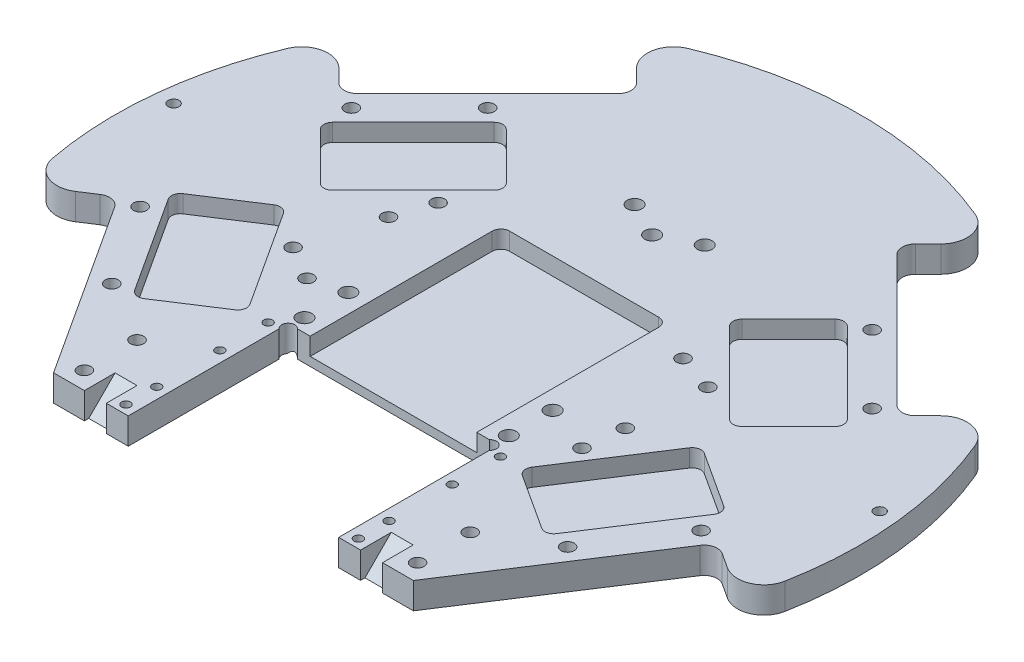
from build123d import *

# Parameters (mm, degrees)
SKETCH1_R                                       = 85
BOSS_EXTRUDE1_DEPTH                             = 6
CUT_EXTRUDE1_REACH                              = 122.358
SKETCH2_R                                       = 1.5
CUT_EXTRUDE2_DEPTH                              = 4
FILLET2_R                                       = 2
FILLET3_R                                       = 6
FILLET4_R                                       = 3
FILLET2_OF_MIRROR1_R                            = 2
FILLET3_OF_MIRROR1_R                            = 6
FILLET4_OF_MIRROR1_R                            = 3
MIRROR2_START                                   = 2
MIRROR2_OUTLINE_R                               = 1.5
MIRROR2_DEPTH                                   = 4
MIRROR2_2_OUTLINE_R                             = 1.5
MIRROR2_2_DEPTH                                 = 2
CUT_EXTRUDE3_REACH                              = 122.358
CUT_EXTRUDE4_REACH                              = 122.358
SKETCH5_R                                       = 1.5
CUT_EXTRUDE5_REACH                              = 122.358
SKETCH6_R                                       = 1.5
CUT_EXTRUDE7_REACH                              = 122.358
SKETCH8_R                                       = 1
SKETCH8_R_2                                     = 1.5
CUT_EXTRUDE8_START                              = -5
CUT_EXTRUDE8_DEPTH                              = 5
CUT_EXTRUDE9_DEPTH                              = 4
CSK_FOR_M3_FLAT_HEAD_MACHINE_SCREW1_D           = 3.4
CSK_FOR_M3_FLAT_HEAD_MACHINE_SCREW1_CSINK_D     = 6.3
CSK_FOR_M3_FLAT_HEAD_MACHINE_SCREW1_CSINK_ANGLE = 90
M3X0_5_TAPPED_HOLE1_D                           = 2.5
M3X0_5_TAPPED_HOLE1_CSINK_D                     = 3.05
M3X0_5_TAPPED_HOLE1_CSINK_ANGLE                 = 90
CHAMFER1_SIZE                                   = 1.65
CHAMFER2_SIZE                                   = 1


# Read off the part's stored shape, not the designer's step: Mirror2
with BuildPart() as part:
    # Sketch1 → Boss-Extrude1 (new body)
    with BuildSketch(Plane(origin=(0, 0, 0), x_dir=(1, 0, 0), z_dir=(0, 1, 0))):
        with Locations(Location((0, 0, 0), (0, 0, 270))):
            Circle(SKETCH1_R)
    extrude(amount=BOSS_EXTRUDE1_DEPTH)

    # Sketch2 → Cut-Extrude1 (cut, up to next)
    with BuildSketch(Plane(origin=(0, 6, 0), x_dir=(1, 0, 0), z_dir=(0, 1, 0)), mode=Mode.PRIVATE) as cut_extrude1_sk1:
        with Locations(Location((-59.39696962, 28.284271247, 0), (0, 0, 270))):
            Circle(SKETCH2_R)
    cut_extrude1_tool1 = extrude(cut_extrude1_sk1.sketch, amount=-CUT_EXTRUDE1_REACH, mode=Mode.PRIVATE) & part.part
    # Sketch2 → Cut-Extrude1 (cut, up to next)
    with BuildSketch(Plane(origin=(0, 6, 0), x_dir=(1, 0, 0), z_dir=(0, 1, 0)), mode=Mode.PRIVATE) as cut_extrude1_sk2:
        with Locations(Location((-43.840620434, 43.840620434, 0), (0, 0, 270))):
            Circle(SKETCH2_R)
    cut_extrude1_tool2 = extrude(cut_extrude1_sk2.sketch, amount=-CUT_EXTRUDE1_REACH, mode=Mode.PRIVATE) & part.part
    # Sketch2 → Cut-Extrude1 (cut, up to next)
    with BuildSketch(Plane(origin=(0, 6, 0), x_dir=(1, 0, 0), z_dir=(0, 1, 0)), mode=Mode.PRIVATE) as cut_extrude1_sk3:
        with BuildLine():
            Line((-40.687914512, 74.629040009), (-29.69848481, 63.639610307))
            Line((-29.69848481, 63.639610307), (-63.639610307, 29.69848481))
            Line((-63.639610307, 29.69848481), (-74.629040009, 40.687914512))
            ThreePointArc((-74.629040009, 40.687914512), (-60.104076401, 60.104076401), (-40.687914512, 74.629040009))
        make_face()
    cut_extrude1_tool3 = extrude(cut_extrude1_sk3.sketch, amount=-CUT_EXTRUDE1_REACH, mode=Mode.PRIVATE) & part.part
    cut_extrude1_1 = cut_extrude1_tool1.solids().sort_by_distance((-59.39697, 6, -28.284271))[0]
    add(cut_extrude1_1, mode=Mode.SUBTRACT)
    cut_extrude1_2 = cut_extrude1_tool2.solids().sort_by_distance((-43.84062, 6, -43.84062))[0]
    add(cut_extrude1_2, mode=Mode.SUBTRACT)
    cut_extrude1_3 = cut_extrude1_tool3.solids().sort_by_distance((-53.003264, 6, -53.003264))[0]
    add(cut_extrude1_3, mode=Mode.SUBTRACT)
    cut_extrude1 = cut_extrude1_1 + cut_extrude1_2 + cut_extrude1_3  # Cut-Extrude1 as one shape, for the pattern or mirror that repeats it

    # Sketch3 → Cut-Extrude2 (cut)
    with BuildSketch(Plane(origin=(0, 6, 0), x_dir=(1, 0, 0), z_dir=(0, 1, 0))):
        Polygon((-60.104076401, 21.920310217), (-38.890872965, 43.133513652), (-25.455844123, 29.69848481), (-46.669047558, 8.485281374), align=None)
    cut_extrude2 = extrude(amount=-CUT_EXTRUDE2_DEPTH, mode=Mode.SUBTRACT)

    # Fillet2
    fillet2_edges = [part.edges().sort_by_distance(p)[0] for p in [
        (-46.669047558, 4, -8.485281374),
        (-60.104076401, 4, -21.920310217),
        (-38.890872965, 4, -43.133513652),
        (-25.455844123, 4, -29.69848481),
    ]]
    fillet(fillet2_edges, radius=FILLET2_R)

    # Fillet3
    fillet3_edges = [part.edges().sort_by_distance(p)[0] for p in [
        (-74.629040009, 3, -40.687914512),
        (-40.687914512, 3, -74.629040009),
    ]]
    fillet(fillet3_edges, radius=FILLET3_R)

    # Fillet4
    fillet4_edges = [part.edges().sort_by_distance(p)[0] for p in [
        (-29.69848481, 3, -63.639610307),
        (-63.639610307, 3, -29.69848481),
    ]]
    fillet(fillet4_edges, radius=FILLET4_R)

    # Mirror1: Cut-Extrude1, Cut-Extrude2 across plane
    add(cut_extrude1.mirror(Plane(origin=(0, 0, 0), x_dir=(0.9945218953682733, 0, 0.10452846326765369), z_dir=(-0.10452846326765369, 0, 0.9945218953682733))), mode=Mode.SUBTRACT)
    add(cut_extrude2.mirror(Plane(origin=(0, 0, 0), x_dir=(0.9945218953682733, 0, 0.10452846326765369), z_dir=(-0.10452846326765369, 0, 0.9945218953682733))), mode=Mode.SUBTRACT)

    # Fillet2 of Mirror1
    fillet2_of_mirror1_edges = [part.edges().sort_by_distance(p)[0] for p in [
        (-47.413406095, 4, -1.403182969),
        (-63.348146886, 4, 8.944958696),
        (-47.008975836, 4, 34.105075735),
        (-31.074235045, 4, 23.756934069),
    ]]
    fillet(fillet2_of_mirror1_edges, radius=FILLET2_OF_MIRROR1_R)

    # Fillet3 of Mirror1
    fillet3_of_mirror1_edges = [part.edges().sort_by_distance(p)[0] for p in [
        (-81.457709532, 3, 24.282536066),
        (-55.315035851, 3, 64.538723328),
    ]]
    fillet(fillet3_of_mirror1_edges, radius=FILLET3_OF_MIRROR1_R)

    # Fillet4 of Mirror1
    fillet4_of_mirror1_edges = [part.edges().sort_by_distance(p)[0] for p in [
        (-42.280920644, 3, 56.074269942),
        (-68.423594325, 3, 15.81808268),
    ]]
    fillet(fillet4_of_mirror1_edges, radius=FILLET4_OF_MIRROR1_R)

    # Mirror2 outline → Mirror2 (cut)
    with BuildSketch(Plane(origin=(0, 0, 0), x_dir=(1, 0, 0), z_dir=(0, 1, 0)).offset(MIRROR2_START)):
        with BuildLine():
            ThreePointArc((43.914837749, -53.558258238), (43.496406651, -55.815910416), (44.796932348, -57.708187047))
            Line((44.796932348, -57.708187047), (48.220507685, -59.931482867))
            ThreePointArc((48.220507685, -59.931482867), (50.952027138, -64.875440225), (48.366800574, -69.89744346))
            ThreePointArc((48.366800574, -69.89744346), (71.286998275, -46.294317976), (83.527042075, -15.755419453))
            ThreePointArc((83.527042075, -15.755419453), (79.990720206, -20.159774174), (74.363181366, -19.675295605))
            Line((74.363181366, -19.675295605), (70.939606029, -17.451999785))
            ThreePointArc((70.939606029, -17.451999785), (68.681953851, -17.033568687), (66.78967722, -18.334094384))
            Line((66.78967722, -18.334094384), (43.914837749, -53.558258238))
        make_face()
        with BuildLine():
            ThreePointArc((68.647443459, 34.706317962), (74.051278315, 36.350240628), (78.426039904, 32.777374283))
            ThreePointArc((78.426039904, 32.777374283), (60.1040764, 60.1040764), (32.777374283, 78.426039904))
            ThreePointArc((32.777374283, 78.426039904), (36.350240628, 74.051278315), (34.706317962, 68.647443459))
            Line((34.706317962, 68.647443459), (31.819805153, 65.76093065))
            ThreePointArc((31.819805153, 65.76093065), (30.941125497, 63.639610307), (31.819805153, 61.518289963))
            Line((31.819805153, 61.518289963), (61.518289963, 31.819805153))
            ThreePointArc((61.518289963, 31.819805153), (63.639610307, 30.941125497), (65.76093065, 31.819805153))
            Line((65.76093065, 31.819805153), (68.647443459, 34.706317962))
        make_face()
        with Locations((63.979633983, -15.316867676)):
            Circle(MIRROR2_OUTLINE_R)
        with Locations((51.997575213, -33.767620171)):
            Circle(MIRROR2_OUTLINE_R)
        with BuildLine():
            ThreePointArc((62.258868816, -10.622299832), (62.537822882, -9.11719838), (61.67080575, -7.855680626))
            Line((61.67080575, -7.855680626), (49.090747231, 0.313904899))
            ThreePointArc((49.090747231, 0.313904899), (47.585645779, 0.592858964), (46.324128025, -0.274158167))
            Line((46.324128025, -0.274158167), (32.163513115, -22.079592934))
            ThreePointArc((32.163513115, -22.079592934), (31.884559049, -23.584694385), (32.751576181, -24.846212139))
            Line((32.751576181, -24.846212139), (45.3316347, -33.015797665))
            ThreePointArc((45.3316347, -33.015797665), (46.836736152, -33.29475173), (48.098253906, -32.427734599))
            Line((48.098253906, -32.427734599), (62.258868816, -10.622299832))
        make_face()
        with Locations((59.39696962, 28.284271247)):
            Circle(MIRROR2_OUTLINE_R)
        with Locations((43.840620434, 43.840620434)):
            Circle(MIRROR2_OUTLINE_R)
        with BuildLine():
            Line((48.083261121, 9.899494937), (58.689862838, 20.506096654))
            ThreePointArc((58.689862838, 20.506096654), (59.275649276, 21.920310216), (58.689862838, 23.334523779))
            Line((58.689862838, 23.334523779), (40.305086528, 41.71930009))
            ThreePointArc((40.305086528, 41.71930009), (38.890872966, 42.305086528), (37.476659403, 41.71930009))
            Line((37.476659403, 41.71930009), (26.870057685, 31.112698372))
            ThreePointArc((26.870057685, 31.112698372), (26.284271247, 29.69848481), (26.870057685, 28.284271247))
            Line((26.870057685, 28.284271247), (45.254833996, 9.899494937))
            ThreePointArc((45.254833996, 9.899494937), (46.669047559, 9.313708499), (48.083261121, 9.899494937))
        make_face()
    extrude(amount=MIRROR2_DEPTH, mode=Mode.SUBTRACT)

    # Mirror2 2 outline → Mirror2 2 (cut)
    with BuildSketch(Plane(origin=(0, 0, 0), x_dir=(1, 0, 0), z_dir=(0, 1, 0))):
        with BuildLine():
            ThreePointArc((43.914837749, -53.558258238), (43.496406651, -55.815910416), (44.796932348, -57.708187047))
            Line((44.796932348, -57.708187047), (48.220507685, -59.931482867))
            ThreePointArc((48.220507685, -59.931482867), (50.952027138, -64.875440225), (48.366800574, -69.89744346))
            ThreePointArc((48.366800574, -69.89744346), (71.286998275, -46.294317976), (83.527042075, -15.755419453))
            ThreePointArc((83.527042075, -15.755419453), (79.990720206, -20.159774174), (74.363181366, -19.675295605))
            Line((74.363181366, -19.675295605), (70.939606029, -17.451999785))
            ThreePointArc((70.939606029, -17.451999785), (68.681953851, -17.033568687), (66.78967722, -18.334094384))
            Line((66.78967722, -18.334094384), (43.914837749, -53.558258238))
        make_face()
        with BuildLine():
            ThreePointArc((68.647443459, 34.706317962), (74.051278315, 36.350240628), (78.426039904, 32.777374283))
            ThreePointArc((78.426039904, 32.777374283), (60.1040764, 60.1040764), (32.777374283, 78.426039904))
            ThreePointArc((32.777374283, 78.426039904), (36.350240628, 74.051278315), (34.706317962, 68.647443459))
            Line((34.706317962, 68.647443459), (31.819805153, 65.76093065))
            ThreePointArc((31.819805153, 65.76093065), (30.941125497, 63.639610307), (31.819805153, 61.518289963))
            Line((31.819805153, 61.518289963), (61.518289963, 31.819805153))
            ThreePointArc((61.518289963, 31.819805153), (63.639610307, 30.941125497), (65.76093065, 31.819805153))
            Line((65.76093065, 31.819805153), (68.647443459, 34.706317962))
        make_face()
        with Locations((63.979633983, -15.316867676)):
            Circle(MIRROR2_2_OUTLINE_R)
        with Locations((51.997575213, -33.767620171)):
            Circle(MIRROR2_2_OUTLINE_R)
        with Locations((59.39696962, 28.284271247)):
            Circle(MIRROR2_2_OUTLINE_R)
        with Locations((43.840620434, 43.840620434)):
            Circle(MIRROR2_2_OUTLINE_R)
    extrude(amount=MIRROR2_2_DEPTH, mode=Mode.SUBTRACT)

    # Sketch4 → Cut-Extrude3 (cut, up to next)
    with BuildSketch(Plane(origin=(0, 6, 0), x_dir=(1, 0, 0), z_dir=(0, 1, 0)), mode=Mode.PRIVATE) as cut_extrude3_sk1:
        Polygon((-43.914837749, -53.558258238), (-41.030336922, -58), (-24, -58), (-24, -21.5), (24, -21.5), (24, -58), (41.030336922, -58), (43.914837749, -53.558258238), (50.952673475, -58.128682198), (50.952673475, -85), (-50.952673475, -85), (-50.952673475, -58.128682198), align=None)
    cut_extrude3_tool1 = extrude(cut_extrude3_sk1.sketch, amount=-CUT_EXTRUDE3_REACH, mode=Mode.PRIVATE) & part.part
    add(cut_extrude3_tool1.solids().sort_by_distance((0, 6, 59.123155))[0], mode=Mode.SUBTRACT)

    # Sketch5 → Cut-Extrude4 (cut, up to next)
    with BuildSketch(Plane(origin=(0, 6, 0), x_dir=(1, 0, 0), z_dir=(0, 1, 0)), mode=Mode.PRIVATE) as cut_extrude4_sk1:
        with Locations((-23, -22.5)):
            Circle(SKETCH5_R)
    cut_extrude4_tool1 = extrude(cut_extrude4_sk1.sketch, amount=-CUT_EXTRUDE4_REACH, mode=Mode.PRIVATE) & part.part
    # Sketch5 → Cut-Extrude4 (cut, up to next)
    with BuildSketch(Plane(origin=(0, 6, 0), x_dir=(1, 0, 0), z_dir=(0, 1, 0)), mode=Mode.PRIVATE) as cut_extrude4_sk2:
        with Locations((23, -22.5)):
            Circle(SKETCH5_R)
    cut_extrude4_tool2 = extrude(cut_extrude4_sk2.sketch, amount=-CUT_EXTRUDE4_REACH, mode=Mode.PRIVATE) & part.part
    add(cut_extrude4_tool1.solids().sort_by_distance((-23, 6, 22.5))[0], mode=Mode.SUBTRACT)
    add(cut_extrude4_tool2.solids().sort_by_distance((23, 6, 22.5))[0], mode=Mode.SUBTRACT)

    # Sketch6 → Cut-Extrude5 (cut, up to next)
    with BuildSketch(Plane(origin=(0, 6, 0), x_dir=(1, 0, 0), z_dir=(0, 1, 0)), mode=Mode.PRIVATE) as cut_extrude5_sk1:
        with Locations(Location((-30.759144982, 19.445436483, 0), (0, 0, 270))):
            Circle(SKETCH6_R)
    cut_extrude5_tool1 = extrude(cut_extrude5_sk1.sketch, amount=-CUT_EXTRUDE5_REACH, mode=Mode.PRIVATE) & part.part
    # Sketch6 → Cut-Extrude5 (cut, up to next)
    with BuildSketch(Plane(origin=(0, 6, 0), x_dir=(1, 0, 0), z_dir=(0, 1, 0)), mode=Mode.PRIVATE) as cut_extrude5_sk2:
        with Locations(Location((-33.587572106, 10.960155108, 0), (0, 0, 270))):
            Circle(SKETCH6_R)
    cut_extrude5_tool2 = extrude(cut_extrude5_sk2.sketch, amount=-CUT_EXTRUDE5_REACH, mode=Mode.PRIVATE) & part.part
    # Sketch6 → Cut-Extrude5 (cut, up to next)
    with BuildSketch(Plane(origin=(0, 6, 0), x_dir=(1, 0, 0), z_dir=(0, 1, 0)), mode=Mode.PRIVATE) as cut_extrude5_sk3:
        with Locations(Location((-38.487029722, -5.915956656, 0), (0, 0, 270))):
            Circle(SKETCH6_R)
    cut_extrude5_tool3 = extrude(cut_extrude5_sk3.sketch, amount=-CUT_EXTRUDE5_REACH, mode=Mode.PRIVATE) & part.part
    # Sketch6 → Cut-Extrude5 (cut, up to next)
    with BuildSketch(Plane(origin=(0, 6, 0), x_dir=(1, 0, 0), z_dir=(0, 1, 0)), mode=Mode.PRIVATE) as cut_extrude5_sk4:
        with Locations(Location((-30.77523517, -10.446765059, 0), (0, 0, 270))):
            Circle(SKETCH6_R)
    cut_extrude5_tool4 = extrude(cut_extrude5_sk4.sketch, amount=-CUT_EXTRUDE5_REACH, mode=Mode.PRIVATE) & part.part
    # Sketch6 → Cut-Extrude5 (cut, up to next)
    with BuildSketch(Plane(origin=(0, 6, 0), x_dir=(1, 0, 0), z_dir=(0, 1, 0)), mode=Mode.PRIVATE) as cut_extrude5_sk5:
        with Locations(Location((35.132347451, -3.737400516, 0), (0, 0, 270))):
            Circle(SKETCH6_R)
    cut_extrude5_tool5 = extrude(cut_extrude5_sk5.sketch, amount=-CUT_EXTRUDE5_REACH, mode=Mode.PRIVATE) & part.part
    # Sketch6 → Cut-Extrude5 (cut, up to next)
    with BuildSketch(Plane(origin=(0, 6, 0), x_dir=(1, 0, 0), z_dir=(0, 1, 0)), mode=Mode.PRIVATE) as cut_extrude5_sk6:
        with Locations(Location((34.129917442, -12.625321199, 0), (0, 0, 270))):
            Circle(SKETCH6_R)
    cut_extrude5_tool6 = extrude(cut_extrude5_sk6.sketch, amount=-CUT_EXTRUDE5_REACH, mode=Mode.PRIVATE) & part.part
    # Sketch6 → Cut-Extrude5 (cut, up to next)
    with BuildSketch(Plane(origin=(0, 6, 0), x_dir=(1, 0, 0), z_dir=(0, 1, 0)), mode=Mode.PRIVATE) as cut_extrude5_sk7:
        with Locations(Location((27.930717857, 16.617009358, 0), (0, 0, 270))):
            Circle(SKETCH6_R)
    cut_extrude5_tool7 = extrude(cut_extrude5_sk7.sketch, amount=-CUT_EXTRUDE5_REACH, mode=Mode.PRIVATE) & part.part
    # Sketch6 → Cut-Extrude5 (cut, up to next)
    with BuildSketch(Plane(origin=(0, 6, 0), x_dir=(1, 0, 0), z_dir=(0, 1, 0)), mode=Mode.PRIVATE) as cut_extrude5_sk8:
        with Locations(Location((36.415999231, 13.788582233, 0), (0, 0, 270))):
            Circle(SKETCH6_R)
    cut_extrude5_tool8 = extrude(cut_extrude5_sk8.sketch, amount=-CUT_EXTRUDE5_REACH, mode=Mode.PRIVATE) & part.part
    add(cut_extrude5_tool1.solids().sort_by_distance((-30.759145, 6, -19.445436))[0], mode=Mode.SUBTRACT)
    add(cut_extrude5_tool2.solids().sort_by_distance((-33.587572, 6, -10.960155))[0], mode=Mode.SUBTRACT)
    add(cut_extrude5_tool3.solids().sort_by_distance((-38.48703, 6, 5.915957))[0], mode=Mode.SUBTRACT)
    add(cut_extrude5_tool4.solids().sort_by_distance((-30.775235, 6, 10.446765))[0], mode=Mode.SUBTRACT)
    add(cut_extrude5_tool5.solids().sort_by_distance((35.132347, 6, 3.737401))[0], mode=Mode.SUBTRACT)
    add(cut_extrude5_tool6.solids().sort_by_distance((34.129917, 6, 12.625321))[0], mode=Mode.SUBTRACT)
    add(cut_extrude5_tool7.solids().sort_by_distance((27.930718, 6, -16.617009))[0], mode=Mode.SUBTRACT)
    add(cut_extrude5_tool8.solids().sort_by_distance((36.415999, 6, -13.788582))[0], mode=Mode.SUBTRACT)

    # Sketch8 → Cut-Extrude7 (cut, up to next)
    with BuildSketch(Plane(origin=(0, 6, 0), x_dir=(1, 0, 0), z_dir=(0, 1, 0)), mode=Mode.PRIVATE) as cut_extrude7_sk1:
        with Locations(Location((-26.5, -23.6, 0), (0, 0, 270))):
            Circle(SKETCH8_R)
    cut_extrude7_tool1 = extrude(cut_extrude7_sk1.sketch, amount=-CUT_EXTRUDE7_REACH, mode=Mode.PRIVATE) & part.part
    # Sketch8 → Cut-Extrude7 (cut, up to next)
    with BuildSketch(Plane(origin=(0, 6, 0), x_dir=(1, 0, 0), z_dir=(0, 1, 0)), mode=Mode.PRIVATE) as cut_extrude7_sk2:
        with Locations(Location((-26.5, -34.6, 0), (0, 0, 270))):
            Circle(SKETCH8_R)
    cut_extrude7_tool2 = extrude(cut_extrude7_sk2.sketch, amount=-CUT_EXTRUDE7_REACH, mode=Mode.PRIVATE) & part.part
    # Sketch8 → Cut-Extrude7 (cut, up to next)
    with BuildSketch(Plane(origin=(0, 6, 0), x_dir=(1, 0, 0), z_dir=(0, 1, 0)), mode=Mode.PRIVATE) as cut_extrude7_sk3:
        with Locations(Location((-26.5, -49, 0), (0, 0, 270))):
            Circle(SKETCH8_R)
    cut_extrude7_tool3 = extrude(cut_extrude7_sk3.sketch, amount=-CUT_EXTRUDE7_REACH, mode=Mode.PRIVATE) & part.part
    # Sketch8 → Cut-Extrude7 (cut, up to next)
    with BuildSketch(Plane(origin=(0, 6, 0), x_dir=(1, 0, 0), z_dir=(0, 1, 0)), mode=Mode.PRIVATE) as cut_extrude7_sk4:
        with Locations(Location((-26.5, -56, 0), (0, 0, 270))):
            Circle(SKETCH8_R)
    cut_extrude7_tool4 = extrude(cut_extrude7_sk4.sketch, amount=-CUT_EXTRUDE7_REACH, mode=Mode.PRIVATE) & part.part
    # Sketch8 → Cut-Extrude7 (cut, up to next)
    with BuildSketch(Plane(origin=(0, 6, 0), x_dir=(1, 0, 0), z_dir=(0, 1, 0)), mode=Mode.PRIVATE) as cut_extrude7_sk5:
        with Locations(Location((-38, -54, 0), (0, 0, 270))):
            Circle(SKETCH8_R_2)
    cut_extrude7_tool5 = extrude(cut_extrude7_sk5.sketch, amount=-CUT_EXTRUDE7_REACH, mode=Mode.PRIVATE) & part.part
    # Sketch8 → Cut-Extrude7 (cut, up to next)
    with BuildSketch(Plane(origin=(0, 6, 0), x_dir=(1, 0, 0), z_dir=(0, 1, 0)), mode=Mode.PRIVATE) as cut_extrude7_sk6:
        with Locations(Location((-38, -42, 0), (0, 0, 270))):
            Circle(SKETCH8_R_2)
    cut_extrude7_tool6 = extrude(cut_extrude7_sk6.sketch, amount=-CUT_EXTRUDE7_REACH, mode=Mode.PRIVATE) & part.part
    cut_extrude7_1 = cut_extrude7_tool1.solids().sort_by_distance((-26.5, 6, 23.6))[0]
    add(cut_extrude7_1, mode=Mode.SUBTRACT)
    cut_extrude7_2 = cut_extrude7_tool2.solids().sort_by_distance((-26.5, 6, 34.6))[0]
    add(cut_extrude7_2, mode=Mode.SUBTRACT)
    cut_extrude7_3 = cut_extrude7_tool3.solids().sort_by_distance((-26.5, 6, 49))[0]
    add(cut_extrude7_3, mode=Mode.SUBTRACT)
    cut_extrude7_4 = cut_extrude7_tool4.solids().sort_by_distance((-26.5, 6, 56))[0]
    add(cut_extrude7_4, mode=Mode.SUBTRACT)
    cut_extrude7_5 = cut_extrude7_tool5.solids().sort_by_distance((-38, 6, 54))[0]
    add(cut_extrude7_5, mode=Mode.SUBTRACT)
    cut_extrude7_6 = cut_extrude7_tool6.solids().sort_by_distance((-38, 6, 42))[0]
    add(cut_extrude7_6, mode=Mode.SUBTRACT)
    cut_extrude7 = cut_extrude7_1 + cut_extrude7_2 + cut_extrude7_3 + cut_extrude7_4 + cut_extrude7_5 + cut_extrude7_6  # Cut-Extrude7 as one shape, for the pattern or mirror that repeats it

    # Mirror3: Cut-Extrude7 across plane
    add(cut_extrude7.mirror(Plane(origin=(0, 0, 0), x_dir=(0, 0, 1), z_dir=(1, 0, 0))), mode=Mode.SUBTRACT)

    # Sketch9 → Cut-Extrude8 (cut)
    with BuildSketch(Plane(origin=(-24, 0, 0), x_dir=(0, 0, -1), z_dir=(1, 0, 0)).offset(CUT_EXTRUDE8_START)):
        Polygon((-51, 6), (-57, 0), (-58, 0), (-58, 6), align=None)
    cut_extrude8 = extrude(amount=-CUT_EXTRUDE8_DEPTH, mode=Mode.SUBTRACT)

    # Mirror4: Cut-Extrude8 across plane
    add(cut_extrude8.mirror(Plane(origin=(0, 0, 0), x_dir=(0, 0, 1), z_dir=(1, 0, 0))), mode=Mode.SUBTRACT)

    # Sketch10 → Cut-Extrude9 (cut)
    with BuildSketch(Plane(origin=(0, 6, 0), x_dir=(1, 0, 0), z_dir=(0, 1, 0))):
        with BuildLine():
            Line((-19, -21.5), (19, -21.5))
            Line((19, -21.5), (19, 20))
            ThreePointArc((19, 20), (18.414213562, 21.414213562), (17, 22))
            Line((17, 22), (-17, 22))
            ThreePointArc((-17, 22), (-18.414213562, 21.414213562), (-19, 20))
            Line((-19, 20), (-19, -21.5))
        make_face()
    extrude(amount=-CUT_EXTRUDE9_DEPTH, mode=Mode.SUBTRACT)

    # CSK for M3 Flat Head Machine Screw1 (through all)
    with Locations(Plane(origin=(0, 0, 0), x_dir=(-1, 0, 0), z_dir=(0, -1, 0))):
        with Locations((23.3, -18.5), (-23.3, -18.5), (-23.3, -8.5), (23.3, -8.5), (8, 41.5), (-8, 41.5), (0, 37.5)):
            CounterSinkHole(CSK_FOR_M3_FLAT_HEAD_MACHINE_SCREW1_D / 2, CSK_FOR_M3_FLAT_HEAD_MACHINE_SCREW1_CSINK_D / 2, counter_sink_angle=CSK_FOR_M3_FLAT_HEAD_MACHINE_SCREW1_CSINK_ANGLE)

    # M3x0.5 Tapped Hole1 (through all)
    with Locations(Plane(origin=(0, 0, 0), x_dir=(-1, 0, 0), z_dir=(0, -1, 0))):
        with Locations((80.534361106, 8.884919378), (-80.534361106, 8.884919378)):
            CounterSinkHole(M3X0_5_TAPPED_HOLE1_D / 2, M3X0_5_TAPPED_HOLE1_CSINK_D / 2, counter_sink_angle=M3X0_5_TAPPED_HOLE1_CSINK_ANGLE)

    # Chamfer1
    chamfer1_edges = [part.edges().sort_by_distance(p)[0] for p in [
        (-64.291501519, 0, 16.784089077),
        (-52.309442749, 0, 35.234841572),
        (62.479633983, 0, 15.316867676),
        (-59.39696962, 0, -29.784271247),
        (50.497575213, 0, 33.767620171),
        (-43.840620434, 0, -45.340620434),
        (57.89696962, 0, -28.284271247),
        (42.340620434, 0, -43.840620434),
        (-38, 0, 52.5),
        (-38, 0, 40.5),
        (38, 0, 52.5),
        (38, 0, 40.5),
    ]]
    chamfer(chamfer1_edges, length=CHAMFER1_SIZE)

    # Chamfer2
    chamfer2_edges = [part.edges().sort_by_distance(p)[0] for p in [
        (-26.5, 0, 22.6),
        (-26.5, 0, 33.6),
        (-26.5, 0, 48),
        (-26.5, 0, 55),
        (26.5, 0, 22.6),
        (26.5, 0, 33.6),
        (26.5, 0, 48),
        (26.5, 0, 55),
    ]]
    chamfer(chamfer2_edges, length=CHAMFER2_SIZE - 0.0001)  # a hair under: the kernel refuses the full size


solid = part.part
